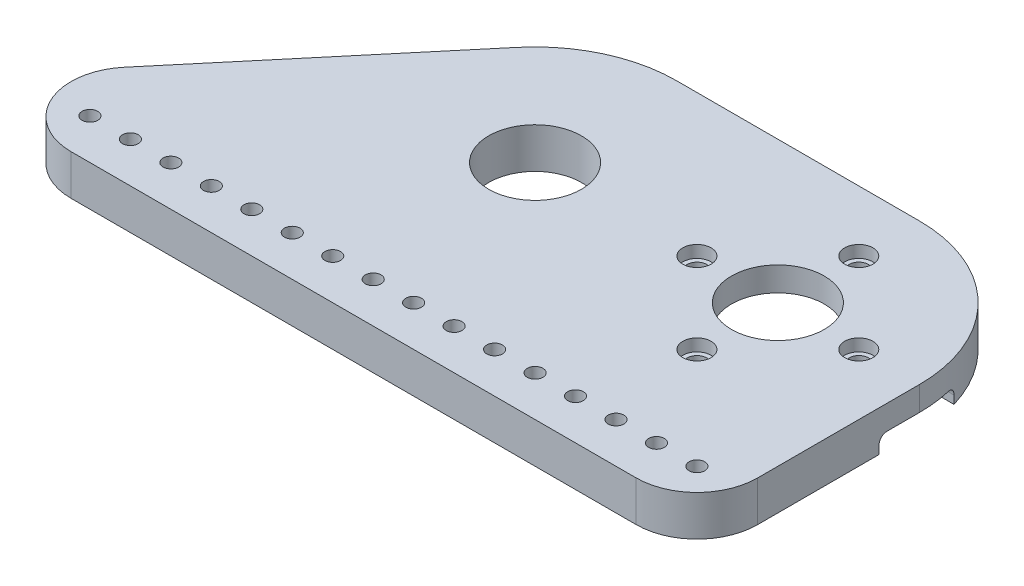
from build123d import *

# Parameters (mm, degrees)
SKETCH1_R                           = 14.551
SKETCH1_R_2                         = 1.27
INITIAL_PLATE_DEPTH                 = 12.7
PLATE_FILLET_R                      = 19.05
F_10_0_1935_INITIAL_MOUNTING_HOLE_D = 4.9149
MOUNTING_PATTERN_COUNT              = 16
MOUNTING_PATTERN_PITCH              = 12.7
SKETCH5_R                           = 3.048
INITIAL_NEO_THROUGHHOLE_DEPTH       = 140.9883388
SKETCH5_4_R                         = 4.445
SKETCH5_4_R_2                       = 3.048
INITIAL_NEO_BOLT_HEAD_HOLE_DEPTH    = 3.81
NEO_HOLE_PATTERN_COUNT              = 4
NEO_CUTOUT_DEPTH                    = 5.08
FILLET1_R                           = 2.54


with BuildPart() as part:
    # Sketch1 → Initial Plate (new body)
    with BuildSketch(Plane(origin=(0, 0, 0), x_dir=(1, 0, 0), z_dir=(0, 1, 0))):
        with BuildLine():
            Line((76.2, 44.45), (0, 44.45))
            ThreePointArc((0, 44.45), (-18.7853815, 40.285381243), (-34.050675165, 28.571909646))
            Line((-34.050675165, 28.571909646), (-116.636463249, -69.85))
            Line((-116.636463249, -69.85), (120.65, -69.85))
            Line((120.65, -69.85), (120.65, 0))
            ThreePointArc((120.65, 0), (107.630896424, 31.430896424), (76.2, 44.45))
        make_face()
        Circle(SKETCH1_R, mode=Mode.SUBTRACT)
        with Locations((76.2, 0)):
            Circle(SKETCH1_R, mode=Mode.SUBTRACT)
        with Locations((107.95, -57.15)):
            Circle(SKETCH1_R_2, mode=Mode.SUBTRACT)
    extrude(amount=INITIAL_PLATE_DEPTH)

    # Plate Fillet
    plate_fillet_edges = [part.edges().sort_by_distance(p)[0] for p in [
        (120.65, 6.35, 69.85),
        (-116.636463249, 6.35, 69.85),
    ]]
    fillet(plate_fillet_edges, radius=PLATE_FILLET_R)

    # #10 (0.1935) Initial Mounting Hole (through all)
    with Locations(Plane(origin=(0, 12.7, 0), x_dir=(1, 0, 0), z_dir=(0, 1, 0))):
        with Locations((107.95, -57.15)):
            f_10_0_1935_initial_mounting_hole = Hole(F_10_0_1935_INITIAL_MOUNTING_HOLE_D / 2)

    # Mounting Pattern: #10 (0.1935) Initial Mounting Hole ×16
    with Locations(*[(-i * MOUNTING_PATTERN_PITCH, 0, 0) for i in range(1, MOUNTING_PATTERN_COUNT)]):
        add(f_10_0_1935_initial_mounting_hole, mode=Mode.SUBTRACT)

    # Sketch5 → Initial NEO ThroughHole (cut, through all)
    with BuildSketch(Plane(origin=(0, 12.7, 0), x_dir=(1, 0, 0), z_dir=(0, 1, 0))):
        with Locations((76.2, 25.4)):
            Circle(SKETCH5_R)
    initial_neo_throughhole = extrude(amount=-INITIAL_NEO_THROUGHHOLE_DEPTH, mode=Mode.SUBTRACT)

    # Sketch5<4> → Initial NEO Bolt Head Hole (cut)
    with BuildSketch(Plane(origin=(0, 12.7, 0), x_dir=(1, 0, 0), z_dir=(0, 1, 0))):
        with Locations((76.2, 25.4)):
            Circle(SKETCH5_4_R)
        with Locations((76.2, 25.4)):
            Circle(SKETCH5_4_R_2, mode=Mode.SUBTRACT)
    initial_neo_bolt_head_hole = extrude(amount=-INITIAL_NEO_BOLT_HEAD_HOLE_DEPTH, mode=Mode.SUBTRACT)

    # NEO Hole Pattern: Initial NEO ThroughHole, Initial NEO Bolt Head Hole ×4 about axis
    neo_hole_pattern_axis = Axis((76.2, 12.7, 0), (0, 1, 0))
    add([initial_neo_throughhole.rotate(neo_hole_pattern_axis, i * 360 / NEO_HOLE_PATTERN_COUNT) for i in range(1, NEO_HOLE_PATTERN_COUNT)], mode=Mode.SUBTRACT)
    add([initial_neo_bolt_head_hole.rotate(neo_hole_pattern_axis, i * 360 / NEO_HOLE_PATTERN_COUNT) for i in range(1, NEO_HOLE_PATTERN_COUNT)], mode=Mode.SUBTRACT)

    # Sketch6 → NEO Cutout (cut)
    with BuildSketch(Plane.XZ):
        with BuildLine():
            Line((103.908128771, 12.7), (120.65, 12.7))
            Line((120.65, 12.7), (120.65, -12.7))
            Line((120.65, -12.7), (103.908128771, -12.7))
            ThreePointArc((103.908128771, -12.7), (45.72, 0), (103.908128771, 12.7))
        make_face()
    extrude(amount=-NEO_CUTOUT_DEPTH, mode=Mode.SUBTRACT)

    # Fillet1
    fillet1_edges = [part.edges().sort_by_distance(p)[0] for p in [
        (111.352611871, 5.08, -12.7),
        (112.279064386, 5.08, 12.7),
    ]]
    fillet(fillet1_edges, radius=FILLET1_R)


solid = part.part
